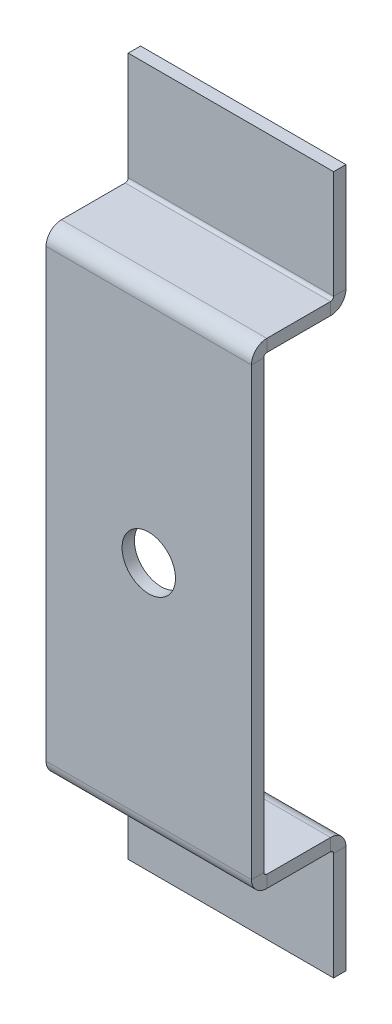
from build123d import *

# Parameters (mm, degrees)
SKETCH_1_W                         = 50
SKETCH_1_H                         = 110
SM_BASE_FLANGE_1_DEPTH             = 3
SM_EDGE_FLANGE_1_STRIP_W           = 13.4732
SM_EDGE_FLANGE_1_STRIP_H           = 3
SM_EDGE_FLANGE_1_STRIP_CUT_DEPTH   = 50
SM_EDGE_FLANGE_1_STRIP_2_W         = 13.4732
SM_EDGE_FLANGE_1_STRIP_2_H         = 3
SM_EDGE_FLANGE_1_STRIP_CUT_2_DEPTH = 50
SM_EDGE_FLANGE_1_DEPTH             = 50
SM_EDGE_FLANGE_1_BEND_DEPTH        = 50
SM_EDGE_FLANGE_2_STRIP_W           = 13.4732
SM_EDGE_FLANGE_2_STRIP_H           = 3
SM_EDGE_FLANGE_2_STRIP_CUT_DEPTH   = 50
SM_EDGE_FLANGE_2_STRIP_2_W         = 13.4732
SM_EDGE_FLANGE_2_STRIP_2_H         = 3
SM_EDGE_FLANGE_2_STRIP_CUT_2_DEPTH = 50
SM_EDGE_FLANGE_2_DEPTH             = 50
SM_EDGE_FLANGE_2_BEND_DEPTH        = 50
SKETCH_18_R                        = 6.5
CUT_EXTRUDE_1_DEPTH                = 151.429385427


# Sheet-metal steps are written as plain solids
with BuildPart() as part:
    # Sketch 1 → 基体-法兰1 (new body)
    with BuildSketch(Plane.XY):
        with Locations((25, 55)):
            Rectangle(SKETCH_1_W, SKETCH_1_H)
    extrude(amount=-SM_BASE_FLANGE_1_DEPTH)

    # 边线-法兰1 strip (across the edge) → 边线-法兰1 strip cut (cut)
    with BuildSketch(Plane(origin=(0, 110, -3), x_dir=(0, -1, 0), z_dir=(1, 0, 0))):
        with Locations((-6, -1.5)):
            Rectangle(SM_EDGE_FLANGE_1_STRIP_W, SM_EDGE_FLANGE_1_STRIP_H)
    extrude(amount=SM_EDGE_FLANGE_1_STRIP_CUT_DEPTH, mode=Mode.SUBTRACT)

    # 边线-法兰1 strip 2 (across the edge) → 边线-法兰1 strip cut 2 (cut)
    with BuildSketch(Plane(origin=(50, 0, -3), x_dir=(0, 1, 0), z_dir=(-1, 0, 0))):
        with Locations((-6, -1.5)):
            Rectangle(SM_EDGE_FLANGE_1_STRIP_2_W, SM_EDGE_FLANGE_1_STRIP_2_H)
    extrude(amount=SM_EDGE_FLANGE_1_STRIP_CUT_2_DEPTH, mode=Mode.SUBTRACT)

    # 边线-法兰1 section (across the edge) → 边线-法兰1 (add)
    with BuildSketch(Plane(origin=(0, 110, -3), x_dir=(0, -1, 0), z_dir=(1, 0, 0))):
        with BuildLine():
            Line((-3, 0.7366), (-3, 17))
            Line((-3, 17), (0, 17))
            Line((0, 17), (0, 0.7366))
            ThreePointArc((0, 0.7366), (0.215745145, 0.215745145), (0.7366, 0))
            Line((0.7366, 0), (0.7366, -3))
            ThreePointArc((0.7366, -3), (-1.905575199, -1.905575199), (-3, 0.7366))
        make_face()
    extrude(amount=SM_EDGE_FLANGE_1_DEPTH)

    # 边线-法兰1 section 2 (across the edge) → 边线-法兰1 bend (add)
    with BuildSketch(Plane(origin=(50, 0, -3), x_dir=(0, 1, 0), z_dir=(-1, 0, 0))):
        with BuildLine():
            Line((-3, 0.7366), (-3, 17))
            Line((-3, 17), (0, 17))
            Line((0, 17), (0, 0.7366))
            ThreePointArc((0, 0.7366), (0.215745145, 0.215745145), (0.7366, 0))
            Line((0.7366, 0), (0.7366, -3))
            ThreePointArc((0.7366, -3), (-1.905575199, -1.905575199), (-3, 0.7366))
        make_face()
    extrude(amount=SM_EDGE_FLANGE_1_BEND_DEPTH)

    # 边线-法兰2 strip (across the edge) → 边线-法兰2 strip cut (cut)
    with BuildSketch(Plane(origin=(0, -3, -20), x_dir=(0, 0, 1), z_dir=(1, 0, 0))):
        with Locations((-6, -1.5)):
            Rectangle(SM_EDGE_FLANGE_2_STRIP_W, SM_EDGE_FLANGE_2_STRIP_H)
    extrude(amount=SM_EDGE_FLANGE_2_STRIP_CUT_DEPTH, mode=Mode.SUBTRACT)

    # 边线-法兰2 strip 2 (across the edge) → 边线-法兰2 strip cut 2 (cut)
    with BuildSketch(Plane(origin=(50, 113, -20), x_dir=(0, 0, 1), z_dir=(-1, 0, 0))):
        with Locations((-6, -1.5)):
            Rectangle(SM_EDGE_FLANGE_2_STRIP_2_W, SM_EDGE_FLANGE_2_STRIP_2_H)
    extrude(amount=SM_EDGE_FLANGE_2_STRIP_CUT_2_DEPTH, mode=Mode.SUBTRACT)

    # 边线-法兰2 section (across the edge) → 边线-法兰2 (add)
    with BuildSketch(Plane(origin=(0, -3, -20), x_dir=(0, 0, 1), z_dir=(1, 0, 0))):
        with BuildLine():
            Line((-3, 0.7366), (-3, 27))
            Line((-3, 27), (0, 27))
            Line((0, 27), (0, 0.7366))
            ThreePointArc((0, 0.7366), (0.215745145, 0.215745145), (0.7366, 0))
            Line((0.7366, 0), (0.7366, -3))
            ThreePointArc((0.7366, -3), (-1.905575199, -1.905575199), (-3, 0.7366))
        make_face()
    extrude(amount=SM_EDGE_FLANGE_2_DEPTH)

    # 边线-法兰2 section 2 (across the edge) → 边线-法兰2 bend (add)
    with BuildSketch(Plane(origin=(50, 113, -20), x_dir=(0, 0, 1), z_dir=(-1, 0, 0))):
        with BuildLine():
            Line((-3, 0.7366), (-3, 27))
            Line((-3, 27), (0, 27))
            Line((0, 27), (0, 0.7366))
            ThreePointArc((0, 0.7366), (0.215745145, 0.215745145), (0.7366, 0))
            Line((0.7366, 0), (0.7366, -3))
            ThreePointArc((0.7366, -3), (-1.905575199, -1.905575199), (-3, 0.7366))
        make_face()
    extrude(amount=SM_EDGE_FLANGE_2_BEND_DEPTH)

    # 草图18 → 切除-拉伸1 (cut, through all)
    with BuildSketch(Plane.XY):
        with Locations((25, 55)):
            Circle(SKETCH_18_R)
    extrude(amount=-CUT_EXTRUDE_1_DEPTH, mode=Mode.SUBTRACT)


solid = part.part
